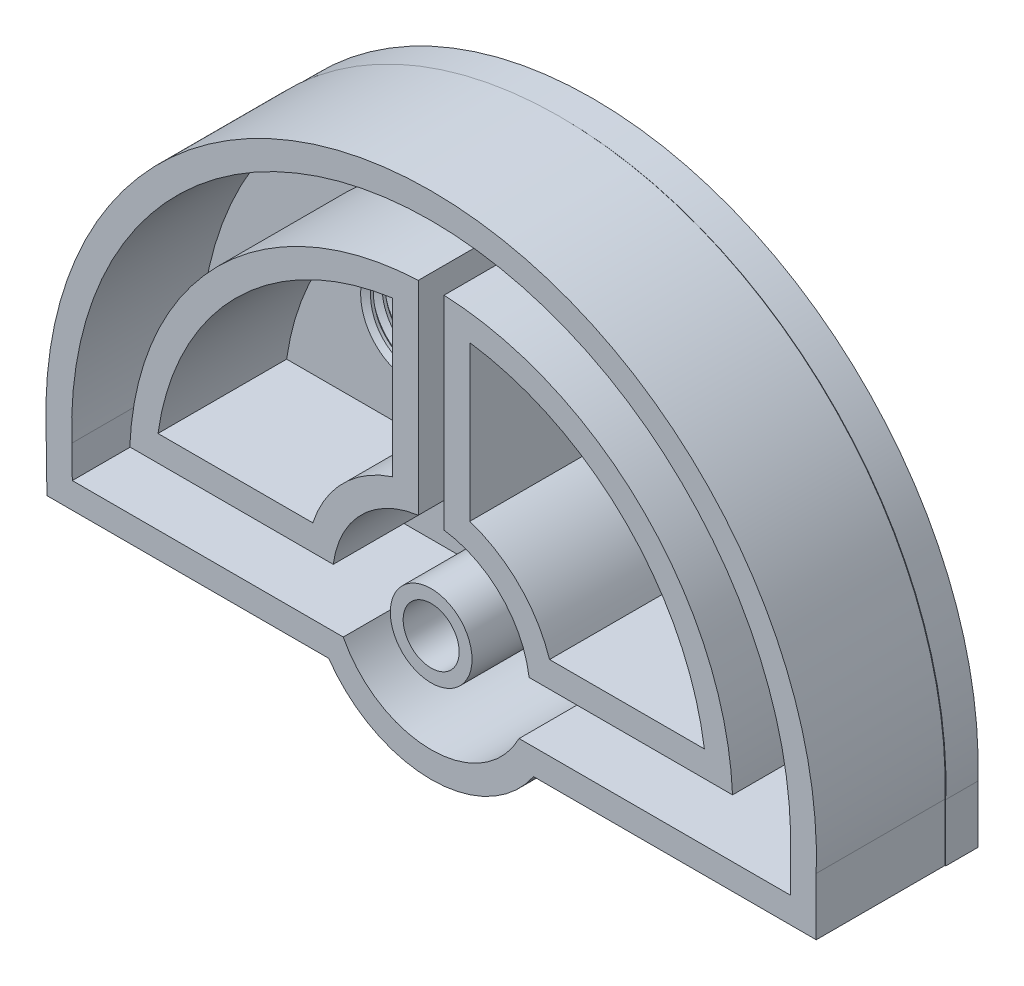
from build123d import *

# Parameters (mm, degrees)
SKETCH1_R             = 3.175
SKETCH1_R_2           = 2.175
BOSS_EXTRUDE1_DEPTH   = 10
BOSS_EXTRUDE1_2_DEPTH = 10
BOSS_EXTRUDE1_3_DEPTH = 10
BOSS_EXTRUDE1_4_DEPTH = 10
BOSS_EXTRUDE2_DEPTH   = 2.5
CUT_EXTRUDE1_START    = -2.5
SKETCH3_R             = 3.918228521
SKETCH3_R_2           = 2.175
CUT_EXTRUDE1_DEPTH    = 2.5
THREAD1_PITCH         = 0.907142857
THREAD2_PITCH         = 0.907142857


with BuildPart() as part:
    # Sketch1 → Boss-Extrude1 (new body)
    with BuildSketch(Plane.XY):
        Circle(SKETCH1_R)
        Circle(SKETCH1_R_2, mode=Mode.SUBTRACT)
    extrude(amount=BOSS_EXTRUDE1_DEPTH)



with BuildPart() as body_2:
    # Sketch1 → Boss-Extrude1 2 (new body)
    with BuildSketch(Plane.XY):
        with BuildLine():
            Line((7.959783027, -5.499770825), (29.922098775, -5.500022961))
            Line((29.922098775, -5.500022961), (29.922098775, -1.03518351))
            ThreePointArc((29.922098775, -1.03518351), (-0.007284723, 29.939999114), (-29.92159149, -1.049744122))
            Line((-29.92159149, -1.049744122), (-29.857873048, -5.499336664))
            Line((-29.857873048, -5.499336664), (-7.959909304, -5.499588061))
            ThreePointArc((-7.959909304, -5.499588061), (-0.000111073, -9.674999998), (7.959783027, -5.499770825))
        make_face()
        with BuildLine():
            Line((-27.922098775, -1), (-27.886307795, -3.499359298))
            Line((-27.886307795, -3.499359298), (-6.830696717, -3.499601024))
            ThreePointArc((-6.830696717, -3.499601024), (-8.8112e-05, -7.674999998), (6.830616362, -3.499757861))
            Line((6.830616362, -3.499757861), (27.922098775, -3.5))
            Line((27.922098775, -3.5), (27.922098775, -1))
            ThreePointArc((27.922098775, -1), (0, 27.94), (-27.922098775, -1))
        make_face(mode=Mode.SUBTRACT)
    extrude(amount=BOSS_EXTRUDE1_2_DEPTH)


with BuildPart() as body_3:
    # Sketch1 → Boss-Extrude1 3 (new body)
    with BuildSketch(Plane.XY):
        with BuildLine():
            Line((-7.609574561, 1), (-23.418659227, 1))
            ThreePointArc((-23.418659227, 1), (-16.574582951, 16.574582951), (-1, 23.418659227))
            Line((-1, 23.418659227), (-1, 7.609574561))
            ThreePointArc((-1, 7.609574561), (-5.427044546, 5.427044546), (-7.609574561, 1))
        make_face()
        with BuildLine():
            Line((-9.198131604, 3), (-21.229074403, 3))
            ThreePointArc((-21.229074403, 3), (-15.160369389, 15.160369389), (-3, 21.229074403))
            Line((-3, 21.229074403), (-3, 9.198131604))
            ThreePointArc((-3, 9.198131604), (-6.841258108, 6.841258108), (-9.198131604, 3))
        make_face(mode=Mode.SUBTRACT)
    extrude(amount=BOSS_EXTRUDE1_3_DEPTH)


with BuildPart() as body_4:
    # Sketch1 → Boss-Extrude1 4 (new body)
    with BuildSketch(Plane.XY):
        with BuildLine():
            Line((7.609574561, 1), (23.418659227, 1))
            ThreePointArc((23.418659227, 1), (16.574582951, 16.574582951), (1, 23.418659227))
            Line((1, 23.418659227), (1, 7.609574561))
            ThreePointArc((1, 7.609574561), (5.427044546, 5.427044546), (7.609574561, 1))
        make_face()
        with BuildLine():
            Line((3, 21.229074403), (3, 9.198131604))
            ThreePointArc((3, 9.198131604), (6.841258108, 6.841258108), (9.198131604, 3))
            Line((9.198131604, 3), (21.229074403, 3))
            ThreePointArc((21.229074403, 3), (15.160369389, 15.160369389), (3, 21.229074403))
        make_face(mode=Mode.SUBTRACT)
    extrude(amount=BOSS_EXTRUDE1_4_DEPTH)


with BuildPart() as part_1:
    add(part.part)

    add(body_2.part)  # Boss-Extrude2 merges body 2

    add(body_3.part)  # Boss-Extrude2 merges body 3

    add(body_4.part)  # Boss-Extrude2 merges body 4
    # Sketch2 → Boss-Extrude2 (add)
    with BuildSketch(Plane.XY):
        with BuildLine():
            Line((8.023501469, -5.499519428), (29.985817217, -5.499771564))
            Line((29.985817217, -5.499771564), (29.985817217, -1.034932113))
            ThreePointArc((29.985817217, -1.034932113), (0.056433719, 29.940250511), (-29.857873048, -1.049492725))
            Line((-29.857873048, -1.049492725), (-29.857873048, -5.499336664))
            Line((-29.857873048, -5.499336664), (-7.896190862, -5.499336664))
            ThreePointArc((-7.896190862, -5.499336664), (0.06360737, -9.6747486), (8.023501469, -5.499519428))
        make_face()
    extrude(amount=-BOSS_EXTRUDE2_DEPTH)

    # Sketch3 → Cut-Extrude1 (cut)
    with BuildSketch(Plane.XY.offset(CUT_EXTRUDE1_START)):
        with Locations((11.000813748, 11.000813748)):
            Circle(SKETCH3_R)
        with Locations(Location((-11.000813748, 11.000813748, 0), (0, 0, 180))):
            Circle(SKETCH3_R)
        Circle(SKETCH3_R_2)
    extrude(amount=CUT_EXTRUDE1_DEPTH, mode=Mode.SUBTRACT)

    # Thread1: the profile of Thread Profile1 profile screwed along a right-hand helix of 2.755906 turns, 8 arcs to a turn; built about Z, then put on its axis
    thread1_z = Axis((0, 0, 0), (0, 0, 1))
    thread1_corners = [(3.91852852, 0, -0.000173205), (3.91852852, 0, 0.793923203), (3.427223048, 0, 0.510267856), (3.427223048, 0, 0.283482142)]
    with BuildLine(mode=Mode.PRIVATE) as thread1_profile:
        Line(thread1_corners[0], thread1_corners[1])
        Line(thread1_corners[1], thread1_corners[2])
        Line(thread1_corners[2], thread1_corners[3])
        Line(thread1_corners[3], thread1_corners[0])
    thread1_cap = Face(thread1_profile.wire())
    thread1_turn_angles = [0, 22.5, 45, 67.5, 90, 112.5, 135, 157.5, 180, 202.5, 225, 247.5, 270, 292.5, 315, 337.5, 360]
    thread1_turn_weights = [1, 0.9238795325112867, 1, 0.9238795325112867, 1, 0.9238795325112867, 1, 0.9238795325112867, 1, 0.9238795325112867, 1, 0.9238795325112867, 1, 0.9238795325112867, 1, 0.9238795325112867, 1]
    thread1_turn_rails = [Edge.make_bspline([Vector(p[0], p[1], 0).rotate(thread1_z, thread1_turn_angles[k]) / thread1_turn_weights[k] + Vector(0, 0, p[2] + THREAD1_PITCH * thread1_turn_angles[k] / 360) for k in range(17)], [0, 0, 0, 1, 1, 2, 2, 3, 3, 4, 4, 5, 5, 6, 6, 7, 7, 8, 8, 8], 2, thread1_turn_weights) for p in thread1_corners]
    thread1_turn_sides = [Face.make_surface_from_curves(thread1_turn_rails[p[0]], thread1_turn_rails[p[1]]) for p in [(0, 1), (1, 2), (2, 3), (3, 0)]]
    thread1_last_angles = [720, 742.5, 765, 787.5, 810, 832.5, 855, 877.5, 900, 922.5, 945, 967.5, 990, 991.062992126, 992.125984252]
    thread1_last_weights = [1, 0.9238795325112867, 1, 0.9238795325112867, 1, 0.9238795325112867, 1, 0.9238795325112867, 1, 0.9238795325112867, 1, 0.9238795325112867, 1, 0.999827903365488, 1]
    thread1_last_rails = [Edge.make_bspline([Vector(p[0], p[1], 0).rotate(thread1_z, thread1_last_angles[k]) / thread1_last_weights[k] + Vector(0, 0, p[2] + THREAD1_PITCH * thread1_last_angles[k] / 360) for k in range(15)], [0, 0, 0, 1, 1, 2, 2, 3, 3, 4, 4, 5, 5, 6, 6, 7, 7, 7], 2, thread1_last_weights) for p in thread1_corners]
    thread1_last_sides = [Face.make_surface_from_curves(thread1_last_rails[p[0]], thread1_last_rails[p[1]]) for p in [(0, 1), (1, 2), (2, 3), (3, 0)]]
    thread1 = Plane(origin=(-11.000813748, 11.000813748, -2.5), x_dir=(1, 0, 0), z_dir=(0, 0, 1)) * Solid(Shell([*[p.moved(Location((0, 0, THREAD1_PITCH * i))) for i in range(2) for p in thread1_turn_sides], *thread1_last_sides, thread1_cap, thread1_cap.rotate(thread1_z, 992.125984252).moved(Location((0, 0, THREAD1_PITCH * 992.125984252 / 360)))]))
    add(thread1)

    # Thread2: the profile of Thread Profile2 profile screwed along a right-hand helix of 2.755906 turns, 8 arcs to a turn; built about Z, then put on its axis
    thread2_z = Axis((0, 0, 0), (0, 0, 1))
    thread2_corners = [(3.918528521, 0, -0.000173205), (3.918528521, 0, 0.793923203), (3.427223049, 0, 0.510267856), (3.427223049, 0, 0.283482142)]
    with BuildLine(mode=Mode.PRIVATE) as thread2_profile:
        Line(thread2_corners[0], thread2_corners[1])
        Line(thread2_corners[1], thread2_corners[2])
        Line(thread2_corners[2], thread2_corners[3])
        Line(thread2_corners[3], thread2_corners[0])
    thread2_cap = Face(thread2_profile.wire())
    thread2_turn_angles = [0, 22.5, 45, 67.5, 90, 112.5, 135, 157.5, 180, 202.5, 225, 247.5, 270, 292.5, 315, 337.5, 360]
    thread2_turn_weights = [1, 0.9238795325112867, 1, 0.9238795325112867, 1, 0.9238795325112867, 1, 0.9238795325112867, 1, 0.9238795325112867, 1, 0.9238795325112867, 1, 0.9238795325112867, 1, 0.9238795325112867, 1]
    thread2_turn_rails = [Edge.make_bspline([Vector(p[0], p[1], 0).rotate(thread2_z, thread2_turn_angles[k]) / thread2_turn_weights[k] + Vector(0, 0, p[2] + THREAD2_PITCH * thread2_turn_angles[k] / 360) for k in range(17)], [0, 0, 0, 1, 1, 2, 2, 3, 3, 4, 4, 5, 5, 6, 6, 7, 7, 8, 8, 8], 2, thread2_turn_weights) for p in thread2_corners]
    thread2_turn_sides = [Face.make_surface_from_curves(thread2_turn_rails[p[0]], thread2_turn_rails[p[1]]) for p in [(0, 1), (1, 2), (2, 3), (3, 0)]]
    thread2_last_angles = [720, 742.5, 765, 787.5, 810, 832.5, 855, 877.5, 900, 922.5, 945, 967.5, 990, 991.062992126, 992.125984252]
    thread2_last_weights = [1, 0.9238795325112867, 1, 0.9238795325112867, 1, 0.9238795325112867, 1, 0.9238795325112867, 1, 0.9238795325112867, 1, 0.9238795325112867, 1, 0.999827903365488, 1]
    thread2_last_rails = [Edge.make_bspline([Vector(p[0], p[1], 0).rotate(thread2_z, thread2_last_angles[k]) / thread2_last_weights[k] + Vector(0, 0, p[2] + THREAD2_PITCH * thread2_last_angles[k] / 360) for k in range(15)], [0, 0, 0, 1, 1, 2, 2, 3, 3, 4, 4, 5, 5, 6, 6, 7, 7, 7], 2, thread2_last_weights) for p in thread2_corners]
    thread2_last_sides = [Face.make_surface_from_curves(thread2_last_rails[p[0]], thread2_last_rails[p[1]]) for p in [(0, 1), (1, 2), (2, 3), (3, 0)]]
    thread2 = Plane(origin=(11.000813748, 11.000813748, -2.5), x_dir=(1, 0, 0), z_dir=(0, 0, 1)) * Solid(Shell([*[p.moved(Location((0, 0, THREAD2_PITCH * i))) for i in range(2) for p in thread2_turn_sides], *thread2_last_sides, thread2_cap, thread2_cap.rotate(thread2_z, 992.125984252).moved(Location((0, 0, THREAD2_PITCH * 992.125984252 / 360)))]))
    add(thread2)


solid = part_1.part
